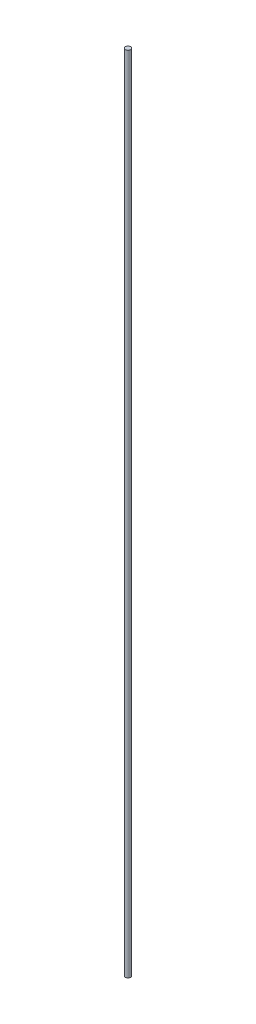
from build123d import *

# Parameters (mm, degrees)
SKETCH1_R           = 3.96875
BOSS_EXTRUDE1_DEPTH = 1219.2


with BuildPart() as part:
    # Sketch1 → Boss-Extrude1 (new body)
    with BuildSketch(Plane(origin=(0, 0, 0), x_dir=(1, 0, 0), z_dir=(0, 1, 0))):
        Circle(SKETCH1_R)
    extrude(amount=BOSS_EXTRUDE1_DEPTH)


solid = part.part
